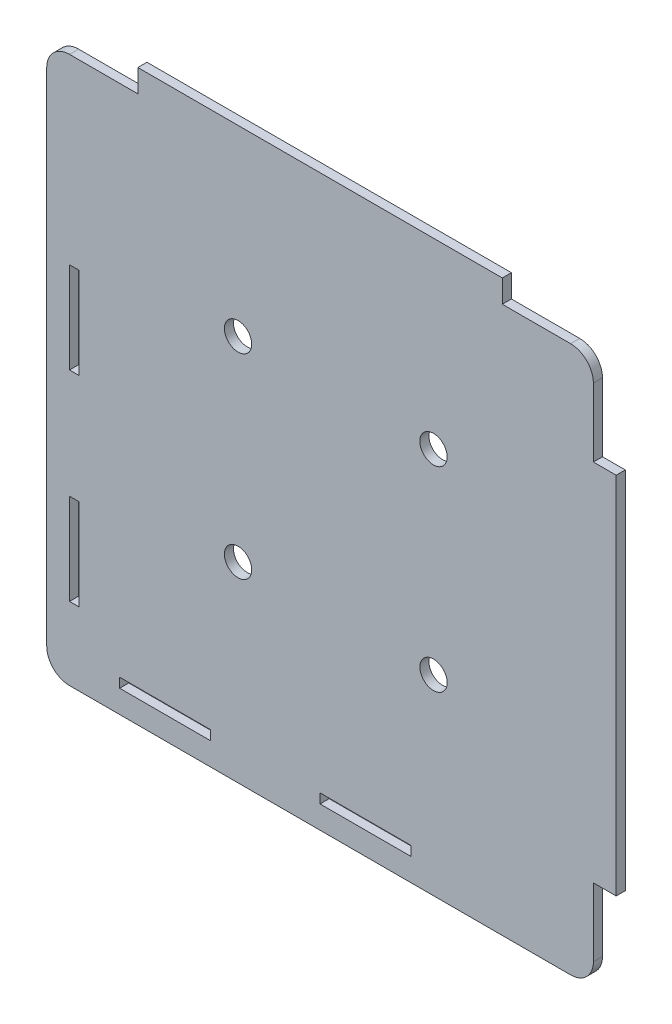
from build123d import *

# Parameters (mm, degrees)
SKETCH1_R          = 3
SKETCH1_W          = 20
SKETCH1_H          = 2.1
SKETCH1_W_2        = 2.1
SKETCH1_H_2        = 20
BASE_FLANGE1_DEPTH = 2
FILLET1_R          = 5


# Sheet-metal steps are written as plain solids
with BuildPart() as part:
    # Sketch1 → Base-Flange1 (new body)
    with BuildSketch(Plane.XY):
        Polygon((0, 0), (120, 0), (120, 20), (125, 20), (125, 100), (120, 100), (120, 120), (100, 120), (100, 125), (20, 125), (20, 120), (0, 120), align=None)
        with Locations((42, 42)):
            Circle(SKETCH1_R, mode=Mode.SUBTRACT)
        with Locations((84.9, 42)):
            Circle(SKETCH1_R, mode=Mode.SUBTRACT)
        with Locations((42, 84.9)):
            Circle(SKETCH1_R, mode=Mode.SUBTRACT)
        with Locations((84.9, 84.9)):
            Circle(SKETCH1_R, mode=Mode.SUBTRACT)
        with Locations((26, 6.05)):
            Rectangle(SKETCH1_W, SKETCH1_H, mode=Mode.SUBTRACT)
        with Locations((70, 6.05)):
            Rectangle(SKETCH1_W, SKETCH1_H, mode=Mode.SUBTRACT)
        with Locations((6.05, 26)):
            Rectangle(SKETCH1_W_2, SKETCH1_H_2, mode=Mode.SUBTRACT)
        with Locations((6.05, 70)):
            Rectangle(SKETCH1_W_2, SKETCH1_H_2, mode=Mode.SUBTRACT)
    extrude(amount=-BASE_FLANGE1_DEPTH)

    # Fillet1
    fillet1_edges = [part.edges().sort_by_distance(p)[0] for p in [
        (0, 120, -1),
        (120, 120, -1),
        (120, 0, -1),
        (0, 0, -1),
    ]]
    fillet(fillet1_edges, radius=FILLET1_R)


solid = part.part
